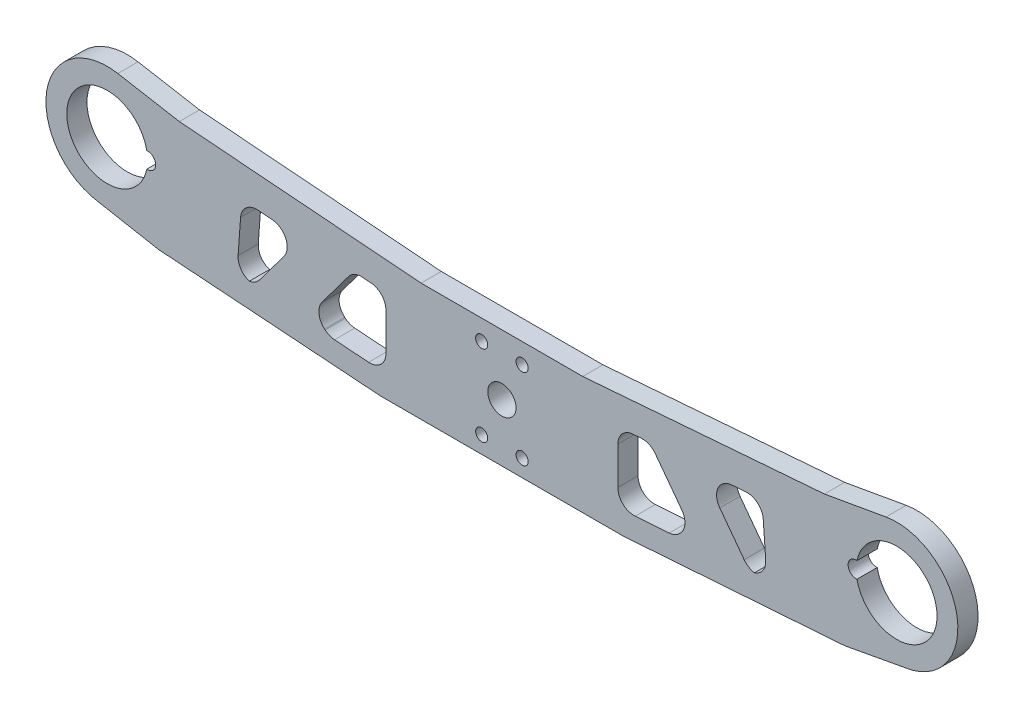
from build123d import *

# Parameters (mm, degrees)
IZIM1_R                     = 1.5
Y_KSEKLIK_EKSTR_ZYON3_DEPTH = 5
KES_EKSTR_ZYON3_DEPTH       = 16
RADYUS1_R                   = 4
RADYUS1_OF_AYNALAMA1_R      = 4


with BuildPart() as part:
    # Çizim1 → Yükseklik-Ekstrüzyon3 (new body)
    with BuildSketch(Plane.XY):
        with BuildLine():
            Line((0, 15.000289945), (20, 15.000289945))
            Line((20, 15.000289945), (79.814271892, 19.717585574))
            Line((79.814271892, 19.717585574), (95.039910294, 22.402276423))
            ThreePointArc((95.039910294, 22.402276423), (112.619627342, 9.95914701), (99.998384592, -7.493135147))
            Line((99.998384592, -7.493135147), (84.9128284, -10.282704371))
            Line((84.9128284, -10.282704371), (30.084066985, -14.204712795))
            Line((30.084066985, -14.204712795), (0, -14.204712795))
            Line((0, -14.204712795), (0, -3.5))
            ThreePointArc((0, -3.5), (3.5, 0), (0, 3.5))
            Line((0, 3.5), (0, 15.000289945))
        make_face()
        with Locations((5, 10.000289945)):
            Circle(IZIM1_R, mode=Mode.SUBTRACT)
        with Locations((5, -10)):
            Circle(IZIM1_R, mode=Mode.SUBTRACT)
    y_kseklik_ekstr_zyon3 = extrude(amount=Y_KSEKLIK_EKSTR_ZYON3_DEPTH)

    # Çizim2 → Kes-Ekstrüzyon3 (cut)
    with BuildSketch(Plane.XY):
        with BuildLine():
            ThreePointArc((87.871148736, 5.489806807), (107.671148736, 7.479781681), (87.871148736, 9.469756555))
            ThreePointArc((87.871148736, 9.469756555), (85.671148736, 7.479781681), (87.871148736, 5.489806807))
        make_face()
        Polygon((65.565337221, -5.727765324), (64.37597588, 10.765231948), (49.583112015, 9.598582086), (61.257040732, -6.035946189), align=None)
        Polygon((42.731699056, -7.748306299), (46.735341753, -4.32569838), (36.65049886, 9.180616861), (28.695940883, 8.553274918), (28.695940883, -8.752311503), align=None)
    kes_ekstr_zyon3 = extrude(amount=KES_EKSTR_ZYON3_DEPTH, mode=Mode.SUBTRACT)

    # Radyus1
    # the kernel refuses this fillet: 4 mm, written as the material it adds along each edge
    with BuildSketch(Plane(origin=(28.695940883, -8.752311503, 0), x_dir=(0.9974513663147316, 0.07134964496670468, 0), z_dir=(0, 0, 1))) as radyus1_piece_1:
        with BuildLine():
            CenterArc((RADYUS1_R * 1.07408709953, RADYUS1_R), RADYUS1_R, 175.908489963, 94.091510037)
            Line((RADYUS1_R * 0.0766357332147, RADYUS1_R * 1.07134964497), (0, 0))
            Line((0, 0), (RADYUS1_R * 1.07408709953, 0))
        make_face()
    extrude(amount=5)
    with BuildSketch(Plane(origin=(64.37597588, 10.765231948, 0), x_dir=(-0.9969045315308735, -0.0786215938099059, 0), z_dir=(0, 0, 1))) as radyus1_piece_2:
        with BuildLine():
            CenterArc((RADYUS1_R * 1.0067369642, RADYUS1_R), RADYUS1_R, 179.615297698, 90.384702302)
            Line((RADYUS1_R * 0.00675950517271, RADYUS1_R * 1.00671427137), (0, 0))
            Line((0, 0), (RADYUS1_R * 1.0067369642, 0))
        make_face()
    extrude(amount=5)
    with BuildSketch(Plane(origin=(49.583112015, 9.598582086, 0), x_dir=(0.5982940894650635, -0.8012765955094225, 0), z_dir=(0, 0, 1))) as radyus1_piece_3:
        with BuildLine():
            CenterArc((RADYUS1_R * 1.81293545135, RADYUS1_R), RADYUS1_R, 147.761521051, 122.238478949)
            Line((RADYUS1_R * 0.967100347397, RADYUS1_R * 1.53344444595), (0, 0))
            Line((0, 0), (RADYUS1_R * 1.81293545135, 0))
        make_face()
    extrude(amount=5)
    with BuildSketch(Plane(origin=(65.565337221, -5.727765324, 0), x_dir=(-0.9974513663147317, -0.07134964496670451, 0), z_dir=(0, 0, 1))) as radyus1_piece_4:
        with BuildLine():
            CenterArc((RADYUS1_R * 1.0005783418, -RADYUS1_R), RADYUS1_R, 90, 90.033126964)
            Line((RADYUS1_R * 0.000578508947597, -RADYUS1_R * 1.00057817457), (0, 0))
            Line((0, 0), (RADYUS1_R * 1.0005783418, 0))
        make_face()
    extrude(amount=5)
    with BuildSketch(Plane(origin=(46.735341753, -4.32569838, 0), x_dir=(-0.5982940894650634, 0.8012765955094225, 0), z_dir=(0, 0, 1))) as radyus1_piece_5:
        with BuildLine():
            CenterArc((RADYUS1_R * 0.936136482984, RADYUS1_R), RADYUS1_R, 183.778435906, 86.221564094)
            Line((-RADYUS1_R * 0.0616898577771, RADYUS1_R * 0.934101641269), (0, 0))
            Line((0, 0), (RADYUS1_R * 0.936136482984, 0))
        make_face()
    extrude(amount=5)
    with BuildSketch(Plane(origin=(36.65049886, 9.180616861, 0), x_dir=(-0.9969045315308735, -0.07862159380990552, 0), z_dir=(0, 0, 1))) as radyus1_piece_6:
        with BuildLine():
            CenterArc((RADYUS1_R * 0.551591618585, RADYUS1_R), RADYUS1_R, 212.238478949, 57.761521051)
            Line((-RADYUS1_R * 0.294243485369, RADYUS1_R * 0.466555554046), (0, 0))
            Line((0, 0), (RADYUS1_R * 0.551591618585, 0))
        make_face()
    extrude(amount=5)
    with BuildSketch(Plane(origin=(28.695940883, 8.553274918, 0), x_dir=(0, -1, 0), z_dir=(0, 0, 1))) as radyus1_piece_7:
        with BuildLine():
            CenterArc((RADYUS1_R * 0.924239359987, RADYUS1_R), RADYUS1_R, 184.509339304, 85.490660696)
            Line((-RADYUS1_R * 0.072665171544, RADYUS1_R * 0.92137840619), (0, 0))
            Line((0, 0), (RADYUS1_R * 0.924239359987, 0))
        make_face()
    extrude(amount=5)
    with BuildSketch(Plane(origin=(42.731699056, -7.748306299, 0), x_dir=(-0.9974513663147319, -0.07134964496670451, 0), z_dir=(0, 0, 1))) as radyus1_piece_8:
        with BuildLine():
            CenterArc((RADYUS1_R * 0.32911927964, -RADYUS1_R), RADYUS1_R, 90, 36.434744123)
            Line((-RADYUS1_R * 0.26478758489, -RADYUS1_R * 0.195466199427), (0, 0))
            Line((0, 0), (RADYUS1_R * 0.32911927964, 0))
        make_face()
    extrude(amount=5)
    with BuildSketch(Plane(origin=(61.257040732, -6.035946189, 0), x_dir=(0.9974513663147319, 0.07134964496670383, 0), z_dir=(0, 0, 1))) as radyus1_piece_9:
        with BuildLine():
            CenterArc((RADYUS1_R * 0.546845511805, RADYUS1_R), RADYUS1_R, 212.656308216, 57.343691784)
            Line((-RADYUS1_R * 0.295076994051, RADYUS1_R * 0.460401543615), (0, 0))
            Line((0, 0), (RADYUS1_R * 0.546845511805, 0))
        make_face()
    extrude(amount=5)

    # Aynalama1: Yükseklik-Ekstrüzyon3, Kes-Ekstrüzyon3 across plane
    add(y_kseklik_ekstr_zyon3.mirror(Plane(origin=(0, 0, 0), x_dir=(0, 0, 1), z_dir=(1, 0, 0))))
    add(kes_ekstr_zyon3.mirror(Plane(origin=(0, 0, 0), x_dir=(0, 0, 1), z_dir=(1, 0, 0))), mode=Mode.SUBTRACT)

    # Radyus1 of Aynalama1
    # the kernel refuses this fillet: 4 mm, written as the material it adds along each edge
    with BuildSketch(Plane(origin=(-28.695940883, -8.752311503, 0), x_dir=(0, 1, 0), z_dir=(0, 0, 1))) as radyus1_of_aynalama1_piece_1:
        with BuildLine():
            CenterArc((RADYUS1_OF_AYNALAMA1_R * 1.07408709953, RADYUS1_OF_AYNALAMA1_R), RADYUS1_OF_AYNALAMA1_R, 175.908489963, 94.091510037)
            Line((RADYUS1_OF_AYNALAMA1_R * 0.0766357332147, RADYUS1_OF_AYNALAMA1_R * 1.07134964497), (0, 0))
            Line((0, 0), (RADYUS1_OF_AYNALAMA1_R * 1.07408709953, 0))
        make_face()
    extrude(amount=5)
    with BuildSketch(Plane(origin=(-64.37597588, 10.765231948, 0), x_dir=(-0.0719263340510189, -0.9974099470478431, 0), z_dir=(0, 0, 1))) as radyus1_of_aynalama1_piece_2:
        with BuildLine():
            CenterArc((RADYUS1_OF_AYNALAMA1_R * 1.0067369642, RADYUS1_OF_AYNALAMA1_R), RADYUS1_OF_AYNALAMA1_R, 179.615297698, 90.384702302)
            Line((RADYUS1_OF_AYNALAMA1_R * 0.00675950517271, RADYUS1_OF_AYNALAMA1_R * 1.00671427137), (0, 0))
            Line((0, 0), (RADYUS1_OF_AYNALAMA1_R * 1.0067369642, 0))
        make_face()
    extrude(amount=5)
    with BuildSketch(Plane(origin=(-49.583112015, 9.598582086, 0), x_dir=(-0.9969045315308733, 0.07862159380990602, 0), z_dir=(0, 0, 1))) as radyus1_of_aynalama1_piece_3:
        with BuildLine():
            CenterArc((RADYUS1_OF_AYNALAMA1_R * 1.81293545135, RADYUS1_OF_AYNALAMA1_R), RADYUS1_OF_AYNALAMA1_R, 147.761521051, 122.238478949)
            Line((RADYUS1_OF_AYNALAMA1_R * 0.967100347397, RADYUS1_OF_AYNALAMA1_R * 1.53344444595), (0, 0))
            Line((0, 0), (RADYUS1_OF_AYNALAMA1_R * 1.81293545135, 0))
        make_face()
    extrude(amount=5)
    with BuildSketch(Plane(origin=(-65.565337221, -5.727765324, 0), x_dir=(0.07192633405101899, 0.9974099470478431, 0), z_dir=(0, 0, 1))) as radyus1_of_aynalama1_piece_4:
        with BuildLine():
            CenterArc((RADYUS1_OF_AYNALAMA1_R * 1.0005783418, -RADYUS1_OF_AYNALAMA1_R), RADYUS1_OF_AYNALAMA1_R, 90, 90.033126964)
            Line((RADYUS1_OF_AYNALAMA1_R * 0.000578508947597, -RADYUS1_OF_AYNALAMA1_R * 1.00057817457), (0, 0))
            Line((0, 0), (RADYUS1_OF_AYNALAMA1_R * 1.0005783418, 0))
        make_face()
    extrude(amount=5)
    with BuildSketch(Plane(origin=(-46.735341753, -4.32569838, 0), x_dir=(0.7601082947002413, -0.6497964145237269, 0), z_dir=(0, 0, 1))) as radyus1_of_aynalama1_piece_5:
        with BuildLine():
            CenterArc((RADYUS1_OF_AYNALAMA1_R * 0.936136482984, RADYUS1_OF_AYNALAMA1_R), RADYUS1_OF_AYNALAMA1_R, 183.778435906, 86.221564094)
            Line((-RADYUS1_OF_AYNALAMA1_R * 0.0616898577771, RADYUS1_OF_AYNALAMA1_R * 0.934101641269), (0, 0))
            Line((0, 0), (RADYUS1_OF_AYNALAMA1_R * 0.936136482984, 0))
        make_face()
    extrude(amount=5)
    with BuildSketch(Plane(origin=(-36.65049886, 9.180616861, 0), x_dir=(-0.5982940894650631, -0.8012765955094229, 0), z_dir=(0, 0, 1))) as radyus1_of_aynalama1_piece_6:
        with BuildLine():
            CenterArc((RADYUS1_OF_AYNALAMA1_R * 0.551591618585, RADYUS1_OF_AYNALAMA1_R), RADYUS1_OF_AYNALAMA1_R, 212.238478949, 57.761521051)
            Line((-RADYUS1_OF_AYNALAMA1_R * 0.294243485369, RADYUS1_OF_AYNALAMA1_R * 0.466555554046), (0, 0))
            Line((0, 0), (RADYUS1_OF_AYNALAMA1_R * 0.551591618585, 0))
        make_face()
    extrude(amount=5)
    with BuildSketch(Plane(origin=(-28.695940883, 8.553274918, 0), x_dir=(-0.9969045315308733, 0.07862159380990584, 0), z_dir=(0, 0, 1))) as radyus1_of_aynalama1_piece_7:
        with BuildLine():
            CenterArc((RADYUS1_OF_AYNALAMA1_R * 0.924239359987, RADYUS1_OF_AYNALAMA1_R), RADYUS1_OF_AYNALAMA1_R, 184.509339304, 85.490660696)
            Line((-RADYUS1_OF_AYNALAMA1_R * 0.072665171544, RADYUS1_OF_AYNALAMA1_R * 0.92137840619), (0, 0))
            Line((0, 0), (RADYUS1_OF_AYNALAMA1_R * 0.924239359987, 0))
        make_face()
    extrude(amount=5)
    with BuildSketch(Plane(origin=(-42.731699056, -7.748306299, 0), x_dir=(-0.7601082947002398, 0.6497964145237288, 0), z_dir=(0, 0, 1))) as radyus1_of_aynalama1_piece_8:
        with BuildLine():
            CenterArc((RADYUS1_OF_AYNALAMA1_R * 0.32911927964, -RADYUS1_OF_AYNALAMA1_R), RADYUS1_OF_AYNALAMA1_R, 90, 36.434744123)
            Line((-RADYUS1_OF_AYNALAMA1_R * 0.26478758489, -RADYUS1_OF_AYNALAMA1_R * 0.195466199427), (0, 0))
            Line((0, 0), (RADYUS1_OF_AYNALAMA1_R * 0.32911927964, 0))
        make_face()
    extrude(amount=5)
    with BuildSketch(Plane(origin=(-61.257040732, -6.035946189, 0), x_dir=(0.5982940894650624, 0.8012765955094232, 0), z_dir=(0, 0, 1))) as radyus1_of_aynalama1_piece_9:
        with BuildLine():
            CenterArc((RADYUS1_OF_AYNALAMA1_R * 0.546845511805, RADYUS1_OF_AYNALAMA1_R), RADYUS1_OF_AYNALAMA1_R, 212.656308216, 57.343691784)
            Line((-RADYUS1_OF_AYNALAMA1_R * 0.295076994051, RADYUS1_OF_AYNALAMA1_R * 0.460401543615), (0, 0))
            Line((0, 0), (RADYUS1_OF_AYNALAMA1_R * 0.546845511805, 0))
        make_face()
    extrude(amount=5)


solid = part.part
